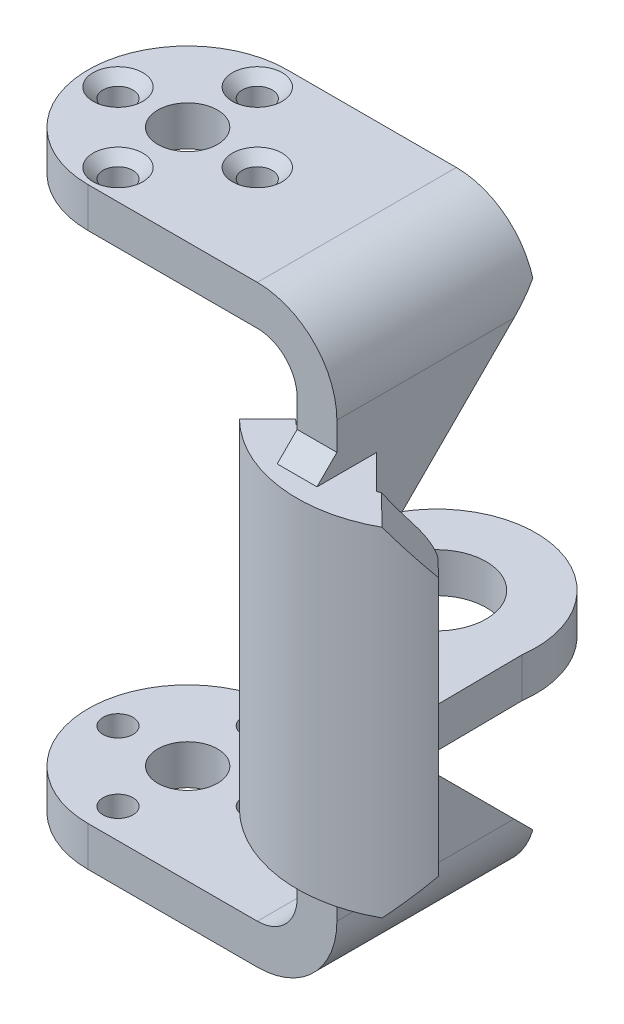
from build123d import *

# Parameters (mm, degrees)
BOSS_EXTRUDE1_DEPTH = 59.6
CUT_EXTRUDE1_DEPTH  = 59.6
SKETCH3_R           = 1.5000000000000004
SKETCH3_R_2         = 1.5000000000000007
SKETCH3_R_3         = 1.5000000000000009
SKETCH3_R_4         = 1.5000000000000002
CUT_EXTRUDE2_DEPTH  = 66.4
CHAMFER1_SIZE       = 1
SKETCH4_R           = 3
CUT_EXTRUDE3_DEPTH  = 66.4
FILLET1_R           = 4
CUT_EXTRUDE4_DEPTH  = 59.6
SKETCH5_R           = 10
BOSS_EXTRUDE2_DEPTH = 2
BOSS_EXTRUDE3_DEPTH = 17
CHAMFER2_SIZE       = 4
CHAMFER2_SIZE_2     = 3.038324347
CHAMFER3_SIZE       = 4
FILLET3_R           = 2
CHAMFER4_SIZE       = 14
CHAMFER5_SIZE       = 2
FILLET4_R           = 8
SKETCH11_R          = 5.000000000000001
CUT_EXTRUDE5_DEPTH  = 4


with BuildPart() as part:
    # Sketch1 → Boss-Extrude1 (new body)
    with BuildSketch(Plane(origin=(0, 0, 0), x_dir=(1, 0, 0), z_dir=(0, 1, 0))):
        with BuildLine():
            ThreePointArc((6.1e-16, 9.999999999999998), (-9.999999999999998, 1.22e-15), (-1.84e-15, -9.999999999999998))
            Line((0, -9.999999999999998), (0, 10.000000000000002))
        make_face()
        with BuildLine():
            Line((0, 10.000000000000002), (0, -9.999999999999998))
            ThreePointArc((-1.84e-15, -9.999999999999998), (7.071067811865472, -7.0710678118654755), (9.999999999999998, -2.45e-15))
            ThreePointArc((9.999999999999998, 0), (7.071067811865475, 7.071067811865474), (6.1e-16, 9.999999999999998))
        make_face()
        with BuildLine():
            ThreePointArc((9.999999999999998, -2.45e-15), (7.071067811865472, -7.0710678118654755), (-1.84e-15, -9.999999999999998))
            Line((0, -9.999999999999998), (25, -9.999999999999998))
            Line((25, -9.999999999999998), (25, 10.000000000000002))
            Line((25, 10), (0, 10.000000000000002))
            ThreePointArc((6.1e-16, 9.999999999999998), (7.071067811865475, 7.071067811865474), (9.999999999999998, 0))
        make_face()
    extrude(amount=BOSS_EXTRUDE1_DEPTH)

    # Sketch2 → Cut-Extrude1 (cut)
    with BuildSketch(Plane.XY.offset(9.999999999999998)):
        Polygon((-9.999999999999998, 4.0000000000000036), (21, 4), (21, 55.599999999999994), (-9.999999999999998, 55.599999999999994), align=None)
    extrude(amount=-CUT_EXTRUDE1_DEPTH, mode=Mode.SUBTRACT)

    # Sketch3 → Cut-Extrude2 (cut, through all)
    with BuildSketch(Plane(origin=(0, 59.6, 0), x_dir=(1, 0, 0), z_dir=(0, 1, 0))):
        with Locations(Location((-7, 0, 0), (0, 0, 270))):
            Circle(SKETCH3_R)
        with Locations(Location((2.444e-14, 7, 0), (0, 0, 270))):
            Circle(SKETCH3_R_2)
        with Locations(Location((7, -4.888e-14, 0), (0, 0, 270))):
            Circle(SKETCH3_R_3)
        with Locations(Location((-7.332e-14, -7.000000000000001, 0), (0, 0, 270))):
            Circle(SKETCH3_R_4)
    extrude(amount=-CUT_EXTRUDE2_DEPTH, mode=Mode.SUBTRACT)

    # Chamfer1
    chamfer1_edges = [part.edges().sort_by_distance(p)[0] for p in [
        (-7, 0, -1.5000000000000004),
        (-7, 59.6, -1.5000000000000004),
        (2.49e-14, 0, -8.5),
        (2.49e-14, 59.6, -8.5),
        (7.000000000000001, 0, -1.499999999999952),
        (7.000000000000001, 59.6, -1.499999999999952),
        (-7.286e-14, 0, 5.500000000000001),
        (-7.286e-14, 59.6, 5.500000000000001),
    ]]
    chamfer(chamfer1_edges, length=CHAMFER1_SIZE)

    # Sketch4 → Cut-Extrude3 (cut, through all)
    with BuildSketch(Plane(origin=(0, 59.6, 0), x_dir=(1, 0, 0), z_dir=(0, 1, 0))):
        with Locations(Location((0, 0, 0), (0, 0, 270))):
            Circle(SKETCH4_R)
    extrude(amount=-CUT_EXTRUDE3_DEPTH, mode=Mode.SUBTRACT)

    # Fillet1
    fillet1_edges = [part.edges().sort_by_distance(p)[0] for p in [
        (21, 4, -1.78e-15),
        (21, 55.599999999999994, -1.78e-15),
    ]]
    fillet(fillet1_edges, radius=FILLET1_R)

    # Sketch6 → Cut-Extrude4 (cut)
    with BuildSketch(Plane(origin=(25, 0, 0), x_dir=(0, 0, -1), z_dir=(1, 0, 0))):
        Polygon((30, 19.799999999999997), (-10, 19.799999999999983), (-9.999999999999998, 39.800000000000004), (30, 39.800000000000004), align=None)
    extrude(amount=-CUT_EXTRUDE4_DEPTH, mode=Mode.SUBTRACT)


with BuildPart() as cut_extrude4_piece_1:
    # of the separate pieces the step leaves, piece 1, a body of its own (cut_extrude4_pieces)
    add(part.part.solids().sort_by_distance((21, 39.8, -10))[0])



with BuildPart() as cut_extrude4_piece_2:
    # of the separate pieces the step leaves, piece 2, a body of its own (cut_extrude4_pieces)
    add(part.part.solids().sort_by_distance((17, 4, -10))[0])


with BuildPart() as body_3:
    # Sketch5 → Boss-Extrude2 (new, symmetric)
    with BuildSketch(Plane(origin=(1.67e-15, 29.8, 0), x_dir=(-1, 6e-17, 0), z_dir=(-6e-17, -1, 0))):
        with Locations(Location((-25, 0, 0), (0, 0, 180))):
            Circle(SKETCH5_R)
    extrude(amount=BOSS_EXTRUDE2_DEPTH, both=True)


with BuildPart() as cut_extrude4_piece_1_1:
    add(cut_extrude4_piece_1.part)

    add(cut_extrude4_piece_2.part)  # Boss-Extrude3 merges Cut-Extrude4 piece 2

    add(body_3.part)  # Boss-Extrude3 merges body 3
    # Sketch8 → Boss-Extrude3 (add, symmetric)
    with BuildSketch(Plane(origin=(1.67e-15, 29.8, 0), x_dir=(-1, 6e-17, 0), z_dir=(-6e-17, -1, 0))):
        with BuildLine():
            Line((-18.00145787776235, -7.1428571428571415), (-15.202041028867285, -9.999999999999998))
            ThreePointArc((-15.202041028867285, -9.999999999999998), (-25.14286458158996, -13.999271042140986), (-35, -9.797958971132715))
            Line((-35, -9.797958971132715), (-32.142857142857146, -6.998542122237653))
            ThreePointArc((-32.142857142857146, -6.998542122237653), (-25.10204612970712, -9.999479315814993), (-18.00145787776235, -7.1428571428571415))
        make_face()
    extrude(amount=BOSS_EXTRUDE3_DEPTH, both=True)

    # Chamfer2
    # the kernel refuses this chamfer: 4, 3.038324347 mm, written as the material it adds along each edge
    with BuildSketch(Plane(origin=(25, 39.800000000000004, 9.999999999999998), x_dir=(0, 0, -1), z_dir=(0, 1, 0))) as chamfer2_piece_1:
        with BuildLine():
            Line((CHAMFER2_SIZE, 0), (0.5968757625671461, -3.403124237432852))
            ThreePointArc((0.5968757625671461, -3.403124237432852), (0.15846004750250664, -1.7731585838259747), (0, 0))
            Line((0, 0), (CHAMFER2_SIZE, 0))
        make_face()
    extrude(amount=6.999999999999993)
    with BuildSketch(Plane(origin=(25, 12.799999999999999, 9.999999999999998), x_dir=(0.9849650815494138, 0, -0.17275354736837392), z_dir=(0, 1, 0))) as chamfer2_piece_2:
        with BuildLine():
            Line((3.4550709473675134, 2e-17), (CHAMFER2_SIZE * 0.172753547368, CHAMFER2_SIZE * 0.984965081549))
            Line((CHAMFER2_SIZE * 0.172753547368, CHAMFER2_SIZE * 0.984965081549), (0, 0))
            ThreePointArc((0, 0), (1.773873824440413, -0.15024182179198892), (3.4550709473675134, 2e-17))
        make_face()
    extrude(amount=6.999999999999984)
    with BuildSketch(Plane(origin=(21, 46.8, 9.165151389911681), x_dir=(0, 0, -1), z_dir=(-6e-17, -1, 0))) as chamfer2_piece_3:
        with BuildLine():
            Line((CHAMFER2_SIZE, 0), (1.5355475582413494, -2.464452441758805))
            ThreePointArc((1.5355475582413494, -2.464452441758805), (0.6874579868810571, -1.3036510598088036), (0, 0))
            Line((0, 0), (CHAMFER2_SIZE, 0))
        make_face()
    extrude(amount=6.999999999999993)
    with BuildSketch(Plane(origin=(21, 19.799999999999983, 9.165151389911681), x_dir=(-0.8336339896703572, 0, -0.5523172740973098), z_dir=(-6e-17, -1, 0))) as chamfer2_piece_4:
        with BuildLine():
            Line((3.4550709473675125, 1.3e-16), (CHAMFER2_SIZE_2 * 0.552317274099, CHAMFER2_SIZE_2 * 0.833633989672))
            Line((CHAMFER2_SIZE_2 * 0.552317274099, CHAMFER2_SIZE_2 * 0.833633989672), (0, 0))
            ThreePointArc((0, 0), (1.7738738244404142, -0.1502418217919865), (3.4550709473675125, 1.3e-16))
        make_face()
    extrude(amount=6.999999999999982)
    # the kernel refuses this chamfer: 4, 3.038324347 mm, written as the material it takes off along each edge
    with BuildSketch(Plane(origin=(42.3476656799026, 46.8, 16.997171657661287), x_dir=(4.2e-16, -1, -4.8e-16), z_dir=(-0.7142857142857139, 0, -0.6998542122237658))) as chamfer2_2_piece_1_section:
        Polygon((CHAMFER2_SIZE, 0), (-2.54e-15, CHAMFER2_SIZE), (0, 0), align=None)
    chamfer2_2_piece_1 = extrude(amount=24.573463903727287, mode=Mode.PRIVATE)
    chamfer2_2_piece_1 = split(chamfer2_2_piece_1, bisect_by=Plane(origin=(25, 46.8, 16.997171657661287), z_dir=(1, 0, 0)), keep=Keep.TOP, mode=Mode.PRIVATE)
    add(chamfer2_2_piece_1, mode=Mode.SUBTRACT)
    with BuildSketch(Plane(origin=(42.3476656799026, 12.799999999999999, 16.997171657661287), x_dir=(-0.6998542122237658, 0, 0.7142857142857139), z_dir=(-0.7142857142857139, 0, -0.6998542122237658))) as chamfer2_2_piece_2_section:
        Polygon((CHAMFER2_SIZE, 0), (-2.54e-15, CHAMFER2_SIZE), (0, 0), align=None)
    chamfer2_2_piece_2 = extrude(amount=24.57346390372729, mode=Mode.PRIVATE)
    chamfer2_2_piece_2 = split(chamfer2_2_piece_2, bisect_by=Plane(origin=(25, 12.799999999999999, 16.997171657661287), z_dir=(1, 0, 0)), keep=Keep.TOP, mode=Mode.PRIVATE)
    add(chamfer2_2_piece_2, mode=Mode.SUBTRACT)

    # Chamfer3
    # the kernel refuses this chamfer: 4 mm, written as the material it adds along each edge
    with BuildSketch(Plane(origin=(32.142857142857146, 31.8, 6.998542122237653), x_dir=(0.7142857142857139, 0, 0.6998542122237658), z_dir=(0, -1, 0))) as chamfer3_piece_1:
        with BuildLine():
            Line((CHAMFER3_SIZE, -9e-17), (-2.0000000000000133, -6.0000000000000115))
            ThreePointArc((-2.0000000000000133, -6.0000000000000115), (-0.5373798977418118, -3.234010018589798), (0, 0))
            Line((0, 0), (CHAMFER3_SIZE, -9e-17))
        make_face()
    extrude(amount=4)

    # Fillet3
    fillet3_edges = [cut_extrude4_piece_1_1.edges().sort_by_distance(p)[0] for p in [
        (32.142857142857146, 37.3, 6.998542122237653),
        (32.142857142857146, 22.3, 6.998542122237653),
    ]]
    fillet(fillet3_edges, radius=FILLET3_R)

    # Chamfer4
    chamfer4_edges = [cut_extrude4_piece_1_1.edges().sort_by_distance(p)[0] for p in [
        (23, 39.800000000000004, -10),
        (23, 19.79999999999999, -10),
    ]]
    chamfer(chamfer4_edges, length=CHAMFER4_SIZE)

    # Chamfer5
    chamfer5_edges = [cut_extrude4_piece_1_1.edges().sort_by_distance(p)[0] for p in [
        (23, 46.8, 9.999999999999998),
        (23, 12.8, 9.999999999999998),
    ]]
    chamfer(chamfer5_edges, length=CHAMFER5_SIZE)

    # Fillet4
    fillet4_edges = [cut_extrude4_piece_1_1.edges().sort_by_distance(p)[0] for p in [
        (25, 0, -1.78e-15),
        (25, 59.6, -1.78e-15),
    ]]
    fillet(fillet4_edges, radius=FILLET4_R)

    # Sketch11 → Cut-Extrude5 (cut)
    with BuildSketch(Plane.XZ.offset(-27.8)):
        with Locations((25, 0)):
            Circle(SKETCH11_R)
    extrude(amount=-CUT_EXTRUDE5_DEPTH, mode=Mode.SUBTRACT)


solid = cut_extrude4_piece_1_1.part
